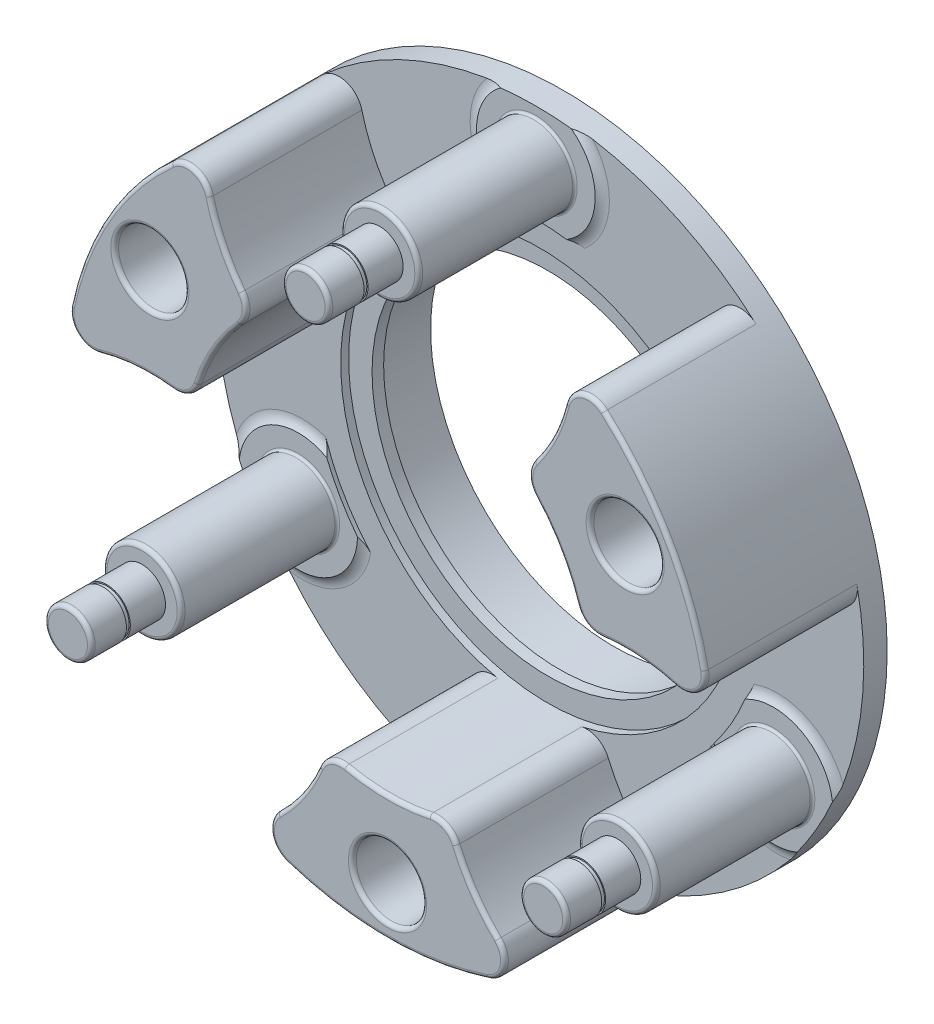
from build123d import *
from build123d.topology import SkipClean

# Parameters (mm, degrees)
SKETCH1_R                = 41.5
SKETCH1_R_2              = 3.000000000000001
SKETCH1_R_3              = 25.5
SKETCH1_R_4              = 2.9999999999999973
SKETCH1_R_5              = 3.0000000000000004
SKETCH1_R_6              = 2.100000000000001
SKETCH1_R_7              = 2.0999999999999988
BOSS_EXTRUDE1_DEPTH      = 3
SKETCH3_R                = 4.5000000000000036
SKETCH3_R_2              = 4.500000000005154
SKETCH3_R_3              = 4.500000000001759
BOSS_EXTRUDE2_DEPTH      = 19.5
SKETCH9_R                = 3.0000000000000018
BOSS_EXTRUDE3_DEPTH      = 0.5
FILLET4_R                = 2
FILLET5_R                = 3
CUT_EXTRUDE5_DEPTH       = 17.5
SKETCH12_R               = 4.999999999999999
CUT_EXTRUDE6_DEPTH       = 2
SKETCH13_R               = 4.500000000000002
SKETCH13_R_2             = 2.100000000000001
BOSS_EXTRUDE5_DEPTH      = 9.5
FILLET7_R                = 0.5
CIRPATTERN2_COUNT        = 3
FILLET4_OF_CIRPATTERN2_R = 2
SKETCH15_R               = 4.500000000000002
SKETCH15_R_2             = 2.100000000000001
SKETCH15_R_3             = 4.500000000000005
SKETCH15_R_4             = 2.0999999999999983
BOSS_EXTRUDE8_DEPTH      = 11.4
CHAMFER2_SIZE            = 0.5
FILLET8_R                = 0.3
BOSS_EXTRUDE10_START     = -3
SKETCH18_R               = 3.000000000000003
BOSS_EXTRUDE10_DEPTH     = 3
CIRPATTERN4_COUNT        = 3
BOSS_EXTRUDE11_START     = 22
SKETCH19_R               = 4.999999999999997
BOSS_EXTRUDE11_DEPTH     = 22
CIRPATTERN6_COUNT        = 3
FILLET11_R               = 0.5
FILLET13_R               = 0.3
SKETCH20_R               = 3.000000000000003
CUT_EXTRUDE7_DEPTH       = 1.5
CIRPATTERN8_COUNT        = 3
SKETCH21_R               = 3.000000000000001
BOSS_EXTRUDE12_DEPTH     = 9.5
CIRPATTERN9_COUNT        = 3
FILLET14_R               = 0.5
SKETCH22_R               = 3.000000000000001
SKETCH22_R_2             = 2.8499999999999996
CUT_EXTRUDE8_DEPTH       = 0.5
CIRPATTERN10_COUNT       = 3


with BuildPart() as part:
    # Sketch1 → Boss-Extrude1 (new body)
    with BuildSketch(Plane.XY):
        Circle(SKETCH1_R)
        with Locations((0, 35.1474)):
            Circle(SKETCH1_R_2, mode=Mode.SUBTRACT)
        Circle(SKETCH1_R_3, mode=Mode.SUBTRACT)
        with Locations((30.438541276975418, -17.573699999998702)):
            Circle(SKETCH1_R_4, mode=Mode.SUBTRACT)
        with Locations((-30.43854127697093, -17.573700000001303)):
            Circle(SKETCH1_R_5, mode=Mode.SUBTRACT)
        with Locations((-30.438541276973226, 17.57369999999992)):
            Circle(SKETCH1_R_6, mode=Mode.SUBTRACT)
        with Locations((30.43854127697314, 17.573700000002663)):
            Circle(SKETCH1_R_6, mode=Mode.SUBTRACT)
        with Locations((2.34127e-12, -35.147399999998726)):
            Circle(SKETCH1_R_7, mode=Mode.SUBTRACT)
    extrude(amount=BOSS_EXTRUDE1_DEPTH)

    # Sketch3 → Boss-Extrude2 (add)
    # profile 1 of 3: a face of its own
    with BuildSketch(Plane.XY.offset(3)):
        with BuildLine():
            ThreePointArc((-17.04322367992892, 18.967828726449188), (-21.649633457038355, 26.00719370167796), (-23.481610059132908, 34.21788989740371))
            ThreePointArc((-23.481610059132755, 34.217889897403595), (-35.94005425705337, 20.750000000001446), (-41.37436694461654, 3.2267258842707123))
            ThreePointArc((-41.374366944616064, 3.2267258842702056), (-33.34770715531379, 5.745535705581741), (-24.948233371699867, 5.2759503059794355))
            ThreePointArc((-24.94823337170057, 5.275950305979563), (-22.083647796501857, 12.750000000002304), (-17.043223679928914, 18.96782872644917))
        make_face()
        with Locations((-30.438541276973226, 17.573699999999914)):
            Circle(SKETCH3_R, mode=Mode.SUBTRACT)
    # profile 2 of 3: a face of its own
    with BuildSketch(Plane.XY.offset(3)):
        with BuildLine():
            ThreePointArc((41.37436694461583, 3.2267258842797224), (35.94005425705123, 20.750000000005144), (23.481610059133157, 34.21788989740332))
            ThreePointArc((23.481610059132883, 34.217889897403126), (21.649633457038238, 26.007193701677682), (17.043223679928904, 18.967828726449163))
            ThreePointArc((17.043223679928907, 18.967828726449177), (22.083647796500625, 12.750000000004434), (24.948233371699555, 5.27595030598437))
            ThreePointArc((24.948233371699835, 5.27595030598442), (33.347707155313074, 5.7455357055883916), (41.37436694461548, 3.2267258842792828))
        make_face()
        with Locations((30.438541276973133, 17.573700000005243)):
            Circle(SKETCH3_R_2, mode=Mode.SUBTRACT)
    # profile 3 of 3: a face of its own
    with BuildSketch(Plane.XY.offset(3)):
        with BuildLine():
            ThreePointArc((-7.905009691767617, -24.243779032425145), (-11.698073698272761, -31.752729407257053), (-17.89275688548132, -37.44461578167187))
            ThreePointArc((-17.892756885481205, -37.44461578167234), (8.7613e-13, -41.50000000000001), (17.892756885482754, -37.4446157816716))
            ThreePointArc((17.89275688548277, -37.44461578167134), (11.698073698274484, -31.752729407256375), (7.905009691769205, -24.24377903242462))
            ThreePointArc((7.905009691769215, -24.243779032424683), (8.1066e-13, -25.5), (-7.905009691767652, -24.24377903242519))
        make_face()
        with Locations((4.57779e-12, -35.14739999999742)):
            Circle(SKETCH3_R_3, mode=Mode.SUBTRACT)
    extrude(amount=BOSS_EXTRUDE2_DEPTH)

    # Sketch9 → Boss-Extrude3 (add)
    with BuildSketch(Plane.XY.offset(3)):
        with BuildLine():
            ThreePointArc((3.9457447685074585, 28.65193248627968), (7.5919415332499876, 34.797508937362196), (4.5264649351877795, 41.25240738660613))
            ThreePointArc((4.5264649351877795, 41.25240738660613), (2.54e-15, 41.50000000000001), (-4.5264649351877795, 41.25240738660613))
            ThreePointArc((-4.5264649351877795, 41.25240738660613), (-7.591941533249986, 34.797508937362196), (-3.9457447685074594, 28.65193248627968))
            ThreePointArc((-3.9457447685074594, 28.65193248627968), (1.77e-15, 28.922346671328953), (3.9457447685074585, 28.65193248627968))
        make_face()
        with Locations((0, 35.1474)):
            Circle(SKETCH9_R, mode=Mode.SUBTRACT)
    boss_extrude3 = extrude(amount=BOSS_EXTRUDE3_DEPTH)

    # Fillet4
    # the kernel refuses this fillet: 2 mm, written as the material it adds along each edge
    with BuildSketch(Plane(origin=(-4.4e-16, 35.14739999999999, 3), x_dir=(-0.20118624054206752, 0.9795530085791934, 0), z_dir=(0.9795530085791934, 0.20118624054206752, 0))) as fillet4_piece_1_section:
        with BuildLine():
            CenterArc((8.922875655532293, 1.9999999999999998), FILLET4_R, 228.59037789072903, 41.40962210927097)
            Line((7.599999999999995, 0.5000000000000017), (7.5735424868893455, 0.4700000000000019))
            ThreePointArc((7.5735424868893455, 0.4700000000000019), (7.5599999999999925, 0.25000000000000083), (7.560000000000029, 0))
            Line((7.560000000000029, 0), (7.600000000000032, -0.04000000000000003))
            Line((7.600000000000032, -0.04000000000000003), (8.922875655532295, -0.04000000000000003))
            Line((8.922875655532295, -0.04000000000000003), (8.922875655532293, 0))
        make_face()
    fillet4_piece_1 = revolve(axis=Axis((-4.4e-16, 35.14739999999999, 3), (0, 0, 1)), revolution_arc=162.0647942771636, mode=Mode.PRIVATE)
    fillet4_piece_1 = fillet4_piece_1 & Plane(origin=(0, 0, 3.1142136524207724), x_dir=(1, 0, 0), z_dir=(0, 0, -1)) * Cylinder(41.5, 36, mode=Mode.PRIVATE)
    fillet4_piece_1 = fillet4_piece_1 - Plane(origin=(-4.4e-16, -6.3238e-13, 3.1142136524207724), x_dir=(-0.1364254710499973, 0.9906503373283564, 0), z_dir=(0, 0, -1)) * Cylinder(28.92234667132958, 36, mode=Mode.PRIVATE)
    add(fillet4_piece_1)
    with BuildSketch(Plane(origin=(1.33e-15, 35.14739999999999, 3), x_dir=(0.11023513080754486, -0.9939055367266265, 0), z_dir=(-0.9939055367266265, -0.11023513080754486, 0))) as fillet4_piece_2_section:
        with BuildLine():
            CenterArc((8.922875655532295, 2), FILLET4_R, 228.59037789072914, 41.409622109270856)
            Line((7.599999999999999, 0.49999999999999956), (7.573542486889352, 0.46999999999999975))
            ThreePointArc((7.573542486889352, 0.46999999999999975), (7.559999999999998, 0.25), (7.56000000000002, 0))
            Line((7.56000000000002, 0), (7.60000000000002, -0.04000000000000004))
            Line((7.60000000000002, -0.04000000000000004), (8.922875655532295, -0.04000000000000004))
            Line((8.922875655532295, -0.04000000000000004), (8.922875655532295, 0))
        make_face()
    fillet4_piece_2 = revolve(axis=Axis((1.33e-15, 35.14739999999999, 3), (0, 0, 1)), revolution_arc=162.06479427716363, mode=Mode.PRIVATE)
    fillet4_piece_2 = fillet4_piece_2 & Plane(origin=(0, 0, 3.1142136533211464), x_dir=(1, 0, 0), z_dir=(0, 0, -1)) * Cylinder(41.5, 36, mode=Mode.PRIVATE)
    fillet4_piece_2 = fillet4_piece_2 - Plane(origin=(-4.4e-16, -6.3238e-13, 3.1142136533211464), x_dir=(-0.1364254710499973, 0.9906503373283564, 0), z_dir=(0, 0, -1)) * Cylinder(28.92234667132958, 36, mode=Mode.PRIVATE)
    add(fillet4_piece_2)

    # Fillet5
    # the kernel refuses this fillet: 3 mm, written as the material it takes off along each edge
    with BuildSketch(Plane(origin=(-41.3743669446163, 3.226725884270455, 3), x_dir=(0.14201179907654285, 0.9898649649942378, 0), z_dir=(0, 0, 1))) as fillet5_piece_1:
        with BuildLine():
            CenterArc((5.169398324781762, -2.993730320620011), FILLET5_R, 86.29510986584997, 117.72061848617085)
            ThreePointArc((2.4290970168052204, -4.214692540142817), (1.3238991334489179, -2.0443231018198946), (0, 0))
            ThreePointArc((0, 0), (2.6816253809806123, 0.08673056475654266), (5.3632507619612255, 0))
        make_face()
    extrude(amount=32.908126904903064, mode=Mode.SUBTRACT)
    with BuildSketch(Plane(origin=(-24.94823337170022, 5.275950305979499, 3), x_dir=(0.25675889841880095, 0.966475487574705, 0), z_dir=(0, 0, 1))) as fillet5_piece_2:
        with BuildLine():
            CenterArc((2.76692669708844, 2.996059200084367), FILLET5_R, 187.71315265443155, 79.34976077385892)
            ThreePointArc((-0.20593055127427304, 2.5934181926630173), (-0.0670495080293914, 1.299560990346834), (0, 0))
            ThreePointArc((0, 0), (1.306604273624909, 0.03349679928286985), (2.613208547249809, -9e-17))
        make_face()
    extrude(amount=26.033021368124523, mode=Mode.SUBTRACT)
    with BuildSketch(Plane(origin=(-17.043223679928918, 18.967828726449177, 3), x_dir=(-0.6472925812907587, 0.7622416376753152, 0), z_dir=(0, 0, 1))) as fillet5_piece_3:
        with BuildLine():
            CenterArc((2.7676396917847796, 2.995400576539178), FILLET5_R, 187.4771359842224, 79.3497607738758)
            ThreePointArc((-0.20685091586524493, 2.6050089462475303), (-0.0700337633072906, 1.305155942949033), (0, 0))
            ThreePointArc((0, 0), (1.300790655138839, 0.03602881710976304), (2.6015813102776955, -3e-17))
        make_face()
    extrude(amount=26.033021368126676, mode=Mode.SUBTRACT)
    with BuildSketch(Plane(origin=(-23.48161005913283, 34.21788989740365, 3), x_dir=(0.1427619117450026, -0.9897570593609889, 0), z_dir=(0, 0, 1))) as fillet5_piece_4:
        with BuildLine():
            CenterArc((5.175085866171874, -2.983887824734681), FILLET5_R, 95.94085094698758, 117.72061848615843)
            ThreePointArc((2.678104690137098, -4.646742300185852), (1.2639086305827807, -2.3666794984363713), (0, 0))
            ThreePointArc((0, 0), (2.432290357100767, -0.12621203957833144), (4.8645807142015185, 6e-17))
        make_face()
    extrude(amount=32.908126904901465, mode=Mode.SUBTRACT)
    with BuildSketch(Plane(origin=(24.948233371699697, 5.275950305984399, 3), x_dir=(-0.25675889841916943, 0.9664754875746071, 0), z_dir=(0, 0, 1))) as fillet5_piece_5:
        with BuildLine():
            CenterArc((2.7669266970879165, -2.9960592000843995), FILLET5_R, 92.9370865716987, 79.34976077386023)
            ThreePointArc((-0.2059305512747297, -2.593418192662554), (-0.06704950802965039, -1.2995609903466103), (0, 0))
            ThreePointArc((0, 0), (1.3066042736249255, -0.03349679928261486), (2.6132085472498505, -6e-17))
        make_face()
    extrude(amount=26.03302136812463, mode=Mode.SUBTRACT)
    with BuildSketch(Plane(origin=(41.37436694461566, 3.226725884279505, 3), x_dir=(-0.14201179907676675, 0.9898649649942056, 0), z_dir=(0, 0, 1))) as fillet5_piece_6:
        with BuildLine():
            CenterArc((5.169398324781412, 2.993730320620015), FILLET5_R, 155.984271647982, 117.72061848616704)
            ThreePointArc((2.4290970168048096, 4.214692540142686), (1.3238991334487102, 2.044323101819835), (0, 0))
            ThreePointArc((0, 0), (2.6816253809804165, -0.08673056475649234), (5.363250761960824, 6e-17))
        make_face()
    extrude(amount=32.90812690490206, mode=Mode.SUBTRACT)
    with BuildSketch(Plane(origin=(23.481610059133025, 34.217889897403225, 3), x_dir=(-0.14276191174505434, -0.9897570593609815, 0), z_dir=(0, 0, 1))) as fillet5_piece_7:
        with BuildLine():
            CenterArc((5.175085866171324, 2.983887824734698), FILLET5_R, 146.33853056685686, 117.72061848615857)
            ThreePointArc((2.678104690136464, 4.646742300185745), (1.2639086305823666, 2.3666794984363593), (0, 0))
            ThreePointArc((0, 0), (2.4322903571005527, 0.12621203957820606), (4.864580714201124, -1e-17))
        make_face()
    extrude(amount=32.90812690490044, mode=Mode.SUBTRACT)
    with BuildSketch(Plane(origin=(17.043223679928907, 18.96782872644917, 3), x_dir=(0.6472925812907598, 0.7622416376753142, 0), z_dir=(0, 0, 1))) as fillet5_piece_8:
        with BuildLine():
            CenterArc((2.7676396917848014, -2.9954005765391774), FILLET5_R, 93.17310324190193, 79.3497607738759)
            ThreePointArc((-0.20685091586522683, -2.605008946247542), (-0.07003376330726978, -1.3051559429490496), (0, 0))
            ThreePointArc((0, 0), (1.3007906551388537, -0.03602881710976737), (2.6015813102777123, 3e-17))
        make_face()
    extrude(amount=26.0330213681267, mode=Mode.SUBTRACT)
    with BuildSketch(Plane(origin=(-7.905009691767635, -24.243779032425167, 3), x_dir=(0.9653717735840792, -0.2608780151088423, 0), z_dir=(0, 0, 1))) as fillet5_piece_9:
        with BuildLine():
            CenterArc((2.766926697088072, -2.996059200084388), FILLET5_R, 92.93708657170235, 79.34976077385885)
            ThreePointArc((-0.2059305512745899, -2.5934181926626616), (-0.06704950802956239, -1.2995609903466645), (0, 0))
            ThreePointArc((0, 0), (1.306604273624906, -0.03349679928270188), (2.613208547249815, -1e-17))
        make_face()
    extrude(amount=26.033021368124537, mode=Mode.SUBTRACT)
    with BuildSketch(Plane(origin=(-17.892756885481262, -37.444615781672105, 3), x_dir=(0.9282541055394802, -0.3719466568596893, 0), z_dir=(0, 0, 1))) as fillet5_piece_10:
        with BuildLine():
            CenterArc((5.169398324781981, 2.9937303206200134), FILLET5_R, 155.9842716479786, 117.72061848617079)
            ThreePointArc((2.429097016805454, 4.214692540142847), (1.32389913344908, 2.04432310181988), (0, 0))
            ThreePointArc((0, 0), (2.6816253809806865, -0.08673056475651277), (5.363250761961412, 0))
        make_face()
    extrude(amount=32.90812690490353, mode=Mode.SUBTRACT)
    with BuildSketch(Plane(origin=(17.892756885482758, -37.44461578167147, 3), x_dir=(-0.9282541055394694, -0.3719466568597162, 0), z_dir=(0, 0, 1))) as fillet5_piece_11:
        with BuildLine():
            CenterArc((5.16939832478169, -2.9937303206200125), FILLET5_R, 86.29510986585171, 117.72061848616684)
            ThreePointArc((2.429097016805103, -4.21469254014271), (1.3238991334489247, -2.0443231018198187), (0, 0))
            ThreePointArc((0, 0), (2.681625380980522, 0.08673056475646362), (5.363250761961062, -8e-17))
        make_face()
    extrude(amount=32.90812690490266, mode=Mode.SUBTRACT)
    with BuildSketch(Plane(origin=(7.9050096917692105, -24.24377903242465, 3), x_dir=(-0.9653717735840623, -0.26087801510890435, 0), z_dir=(0, 0, 1))) as fillet5_piece_12:
        with BuildLine():
            CenterArc((2.7669266970881057, 2.996059200084389), FILLET5_R, 187.71315265443732, 79.34976077386028)
            ThreePointArc((-0.20593055127456747, 2.5934181926627398), (-0.0670495080295619, 1.299560990346695), (0, 0))
            ThreePointArc((0, 0), (1.3066042736249253, 0.03349679928270887), (2.613208547249846, 3e-17))
        make_face()
    extrude(amount=26.03302136812462, mode=Mode.SUBTRACT)

    # Sketch10 → Cut-Extrude5 (cut)
    with SkipClean():  # the faces are left unmerged after this step: merging them gives an invalid solid
        with BuildSketch(Plane(origin=(0, 0, 0), x_dir=(-1, 0, 0), z_dir=(0, 0, -1))):
            with BuildLine():
                ThreePointArc((-29.290515769105856, 8.503863003347483), (-29.017539279441554, 9.393211067893755), (-28.7175663827383, 10.273820178149325))
                ThreePointArc((-28.717566382738358, 10.273820178149368), (-33.757844098667384, 10.848209030714761), (-37.27954390074122, 14.49950366573331))
                ThreePointArc((-37.27954390074116, 14.499503665733304), (-38.34106964762692, 11.400104309862378), (-39.14539599217151, 8.224230822151323))
                ThreePointArc((-39.14539599217151, 8.224230822151327), (-38.700558024866865, 6.818900582741006), (-37.2676944519654, 6.472871855019106))
                ThreePointArc((-37.2676944519654, 6.472871855019111), (-34.022654348244075, 7.165448796156344), (-30.714476806317474, 7.422177145286614))
                ThreePointArc((-30.714476806317474, 7.42217714528661), (-29.823686959517932, 7.727630552913571), (-29.290515769105852, 8.503863003347487))
            make_face()
            with BuildLine():
                ThreePointArc((-31.196710467164433, 25.03528022666748), (-26.27374665549943, 23.81104605107831), (-23.256172459562556, 19.733231933237768))
                ThreePointArc((-23.25617245956254, 19.73323193323776), (-22.64439619458054, 20.432359652833327), (-22.011611339592804, 21.112531023886508))
                ThreePointArc((-22.0116113395928, 21.112531023886504), (-21.606037353269883, 21.96237958558087), (-21.7869335869771, 22.886505869606157))
                ThreePointArc((-21.786933586977092, 22.886505869606157), (-23.21880147694953, 25.879862140672792), (-24.241631081420728, 29.036481696476965))
                ThreePointArc((-24.24163108142073, 29.036481696476965), (-25.257793164485758, 30.10435151696744), (-26.697276827330878, 29.786832829367153))
                ThreePointArc((-26.69727682733088, 29.786832829367153), (-29.044323959215298, 27.50322246123115), (-31.19671046716428, 25.03528022666724))
            make_face()
        cut_extrude5 = extrude(amount=-CUT_EXTRUDE5_DEPTH, mode=Mode.SUBTRACT)

    # Sketch11 → Revolve1 (revolve)
    with SkipClean():  # the faces are left unmerged after this step: merging them gives an invalid solid
        with BuildSketch(Plane(origin=(0, 0, 0), x_dir=(1, 0, 0), z_dir=(0, 1, 0)), mode=Mode.PRIVATE) as revolve1_sk:
            Polygon((-25.500000000000004, 6.5163271707340344), (-23.5, 6.5163271707340344), (-23.5, -0.5), (-22.5, -0.5), (-22.5, -1.9836728292659656), (-25.500000000000004, -1.9836728292659656), align=None)
        revolve(revolve1_sk.sketch.rotate(Axis((0, 0, 0), (0, 0, -1)), 180), axis=Axis((0, 0, 0), (0, 0, -1)))

    # Sketch12 → Cut-Extrude6 (cut)
    with SkipClean():  # the faces are left unmerged after this step: merging them gives an invalid solid
        with BuildSketch(Plane.XY.offset(3.5)):
            with Locations((0, 35.1474)):
                Circle(SKETCH12_R)
        cut_extrude6 = extrude(amount=-CUT_EXTRUDE6_DEPTH, mode=Mode.SUBTRACT)

    # Sketch13 → Boss-Extrude5 (add)
    with SkipClean():  # the faces are left unmerged after this step: merging them gives an invalid solid
        with BuildSketch(Plane.XY.offset(3)):
            with Locations((-30.438541276973226, 17.573699999999914)):
                Circle(SKETCH13_R)
            with Locations((-30.438541276973226, 17.57369999999992)):
                Circle(SKETCH13_R_2, mode=Mode.SUBTRACT)
        extrude(amount=BOSS_EXTRUDE5_DEPTH)

    # Fillet7
    fillet7_edges = [part.edges().sort_by_distance(p)[0] for p in [
        (21.18302071928524, 24.97244873690627, 22.5),
        (-35.94005425705278, 20.75000000000246, 22.5),
        (35.94005425705051, 20.75000000000638, 22.5),
        (1.62537e-12, -41.500000000000014, 22.5),
        (32.218285360505426, 5.85880970335058, 22.5),
        (22.083647796501175, 12.750000000003482, 22.5),
        (39.72319689144136, 5.72484238370884, 22.5),
        (25.52106887290755, 6.189494649312124, 22.5),
        (18.12079403933943, 19.00714665102051, 22.5),
        (24.81945738266606, 31.538876435672478, 22.5),
        (6.1928e-13, -25.500000000000004, 22.5),
        (-22.083647796502405, 12.750000000001346, 22.5),
        (-21.183020719285082, 24.97244873690595, 22.5),
        (-32.2182853605056, 5.858809703344232, 22.5),
        (-39.72319689144118, 5.724842383699793, 22.5),
        (-25.521068872907968, 6.189494649306857, 22.5),
        (-18.12079403933943, 19.00714665102051, 22.5),
        (-24.819457382666094, 31.538876435672545, 22.5),
        (11.03526464122018, -30.83125844024642, 22.5),
        (-11.035264641218017, -30.831258440246465, 22.5),
        (-14.90373950877416, -37.26371881937221, 22.5),
        (-7.400274833566203, -25.196641300324472, 22.5),
        (14.903739508776162, -37.2637188193712, 22.5),
        (7.400274833567389, -25.19664130032457, 22.5),
        (-34.938541276973226, 17.573699999999914, 22.5),
        (25.938541276967978, 17.573700000005243, 22.5),
        (-4.499999999997181, -35.14739999999742, 22.5),
    ]]
    fillet(fillet7_edges, radius=FILLET7_R)

    # CirPattern2: Boss-Extrude3, Cut-Extrude5, Cut-Extrude6 ×3 about axis
    cirpattern2_axis = Axis((1.0439e-13, -2.77e-15, 0), (0, 0, 1))
    add([boss_extrude3.rotate(cirpattern2_axis, i * 360 / CIRPATTERN2_COUNT) for i in range(1, CIRPATTERN2_COUNT)])
    add([cut_extrude5.rotate(cirpattern2_axis, i * 360 / CIRPATTERN2_COUNT) for i in range(1, CIRPATTERN2_COUNT)], mode=Mode.SUBTRACT)
    add([cut_extrude6.rotate(cirpattern2_axis, i * 360 / CIRPATTERN2_COUNT) for i in range(1, CIRPATTERN2_COUNT)], mode=Mode.SUBTRACT)

    # Fillet4 of CirPattern2
    # the kernel refuses this fillet: 2 mm, written as the material it adds along each edge
    with BuildSketch(Plane(origin=(-30.43854127697302, -17.573700000000084, 3), x_dir=(-0.7477246695120235, -0.6640088994909144, 0), z_dir=(-0.6640088994909144, 0.7477246695120235, 0))) as fillet4_of_cirpattern2_piece_1_section:
        with BuildLine():
            CenterArc((8.92287565553229, 2), FILLET4_OF_CIRPATTERN2_R, 228.59037789072912, 41.40962210927091)
            Line((7.599999999999993, 0.5000000000000009), (7.573542486889347, 0.4700000000000011))
            ThreePointArc((7.573542486889347, 0.4700000000000011), (7.559999999999996, 0.25000000000000044), (7.559999999999993, 0))
            Line((7.559999999999993, 0), (7.599999999999999, -0.04000000000000004))
            Line((7.599999999999999, -0.04000000000000004), (8.92287565553229, -0.04000000000000004))
            Line((8.92287565553229, -0.04000000000000004), (8.92287565553229, 0))
        make_face()
    fillet4_of_cirpattern2_piece_1 = revolve(axis=Axis((-30.43854127697302, -17.573700000000084, 3), (0, 0, 1)), revolution_arc=162.0647942771636, mode=Mode.PRIVATE)
    fillet4_of_cirpattern2_piece_1 = fillet4_of_cirpattern2_piece_1 & Plane(origin=(0, 0, 3.1142136524207724), x_dir=(1, 0, 0), z_dir=(0, 0, -1)) * Cylinder(41.5, 36, mode=Mode.PRIVATE)
    fillet4_of_cirpattern2_piece_1 = fillet4_of_cirpattern2_piece_1 - Plane(origin=(7.0207e-13, 2.2125e-13, 3.1142136524207724), x_dir=(-0.7897156228689817, -0.6134730923167342, 0), z_dir=(0, 0, -1)) * Cylinder(28.92234667132958, 36, mode=Mode.PRIVATE)
    add(fillet4_of_cirpattern2_piece_1)
    with BuildSketch(Plane(origin=(-30.43854127697302, -17.573700000000084, 3), x_dir=(0.8056298783634935, 0.5924191920321475, 0), z_dir=(0.5924191920321475, -0.8056298783634935, 0))) as fillet4_of_cirpattern2_piece_2_section:
        with BuildLine():
            CenterArc((8.922875655532295, 1.9999999999999998), FILLET4_OF_CIRPATTERN2_R, 228.59037789072914, 41.409622109270856)
            Line((7.6, 0.4999999999999995), (7.5735424868893535, 0.4699999999999997))
            ThreePointArc((7.5735424868893535, 0.4699999999999997), (7.559999999999996, 0.24999999999999997), (7.5600000000000005, 0))
            Line((7.5600000000000005, 0), (7.6000000000000005, -0.04000000000000003))
            Line((7.6000000000000005, -0.04000000000000003), (8.922875655532295, -0.04000000000000003))
            Line((8.922875655532295, -0.04000000000000003), (8.922875655532295, 0))
        make_face()
    fillet4_of_cirpattern2_piece_2 = revolve(axis=Axis((-30.43854127697302, -17.573700000000084, 3), (0, 0, 1)), revolution_arc=162.06479427716363, mode=Mode.PRIVATE)
    fillet4_of_cirpattern2_piece_2 = fillet4_of_cirpattern2_piece_2 & Plane(origin=(0, 0, 3.1142136533211433), x_dir=(1, 0, 0), z_dir=(0, 0, -1)) * Cylinder(41.5, 36, mode=Mode.PRIVATE)
    fillet4_of_cirpattern2_piece_2 = fillet4_of_cirpattern2_piece_2 - Plane(origin=(7.0207e-13, 2.2125e-13, 3.1142136533211433), x_dir=(-0.7897156228689817, -0.6134730923167342, 0), z_dir=(0, 0, -1)) * Cylinder(28.92234667132958, 36, mode=Mode.PRIVATE)
    add(fillet4_of_cirpattern2_piece_2)
    with BuildSketch(Plane(origin=(30.43854127697332, -17.573699999999924, 3), x_dir=(0.9489109100540908, -0.315544109088281, 0), z_dir=(-0.315544109088281, -0.9489109100540908, 0))) as fillet4_of_cirpattern2_piece_3_section:
        with BuildLine():
            CenterArc((8.922875655532286, 1.9999999999999996), FILLET4_OF_CIRPATTERN2_R, 228.59037789072914, 41.409622109270856)
            Line((7.599999999999991, 0.499999999999999), (7.573542486889343, 0.4699999999999992))
            ThreePointArc((7.573542486889343, 0.4699999999999992), (7.5600000000000005, 0.2499999999999995), (7.560000000000032, 0))
            Line((7.560000000000032, 0), (7.60000000000003, -0.04000000000000003))
            Line((7.60000000000003, -0.04000000000000003), (8.922875655532286, -0.04000000000000003))
            Line((8.922875655532286, -0.04000000000000003), (8.922875655532286, 0))
        make_face()
    fillet4_of_cirpattern2_piece_3 = revolve(axis=Axis((30.43854127697332, -17.573699999999924, 3), (0, 0, 1)), revolution_arc=162.06479427716377, mode=Mode.PRIVATE)
    fillet4_of_cirpattern2_piece_3 = fillet4_of_cirpattern2_piece_3 & Plane(origin=(0, 0, 3.114213652420772), x_dir=(1, 0, 0), z_dir=(0, 0, -1)) * Cylinder(41.5, 36, mode=Mode.PRIVATE)
    fillet4_of_cirpattern2_piece_3 = fillet4_of_cirpattern2_piece_3 - Plane(origin=(-3.8845e-13, 4.0283e-13, 3.114213652420772), x_dir=(0.9261410939189787, -0.37717724501162253, 0), z_dir=(0, 0, -1)) * Cylinder(28.92234667132958, 36, mode=Mode.PRIVATE)
    add(fillet4_of_cirpattern2_piece_3)
    with BuildSketch(Plane(origin=(30.43854127697332, -17.573699999999924, 3), x_dir=(-0.9158650091710376, 0.40148634469448025, 0), z_dir=(0.40148634469448025, 0.9158650091710376, 0))) as fillet4_of_cirpattern2_piece_4_section:
        with BuildLine():
            CenterArc((8.922875655532293, 1.9999999999999998), FILLET4_OF_CIRPATTERN2_R, 228.59037789072912, 41.40962210927091)
            Line((7.599999999999997, 0.5000000000000008), (7.573542486889353, 0.47000000000000103))
            ThreePointArc((7.573542486889353, 0.47000000000000103), (7.559999999999997, 0.2500000000000004), (7.560000000000021, 0))
            Line((7.560000000000021, 0), (7.600000000000023, -0.04000000000000003))
            Line((7.600000000000023, -0.04000000000000003), (8.922875655532293, -0.04000000000000003))
            Line((8.922875655532293, -0.04000000000000003), (8.922875655532293, 0))
        make_face()
    fillet4_of_cirpattern2_piece_4 = revolve(axis=Axis((30.43854127697332, -17.573699999999924, 3), (0, 0, 1)), revolution_arc=162.06479427716377, mode=Mode.PRIVATE)
    fillet4_of_cirpattern2_piece_4 = fillet4_of_cirpattern2_piece_4 & Plane(origin=(0, 0, 3.114213653321144), x_dir=(1, 0, 0), z_dir=(0, 0, -1)) * Cylinder(41.5, 36, mode=Mode.PRIVATE)
    fillet4_of_cirpattern2_piece_4 = fillet4_of_cirpattern2_piece_4 - Plane(origin=(-3.8845e-13, 4.0283e-13, 3.114213653321144), x_dir=(0.9261410939189787, -0.37717724501162253, 0), z_dir=(0, 0, -1)) * Cylinder(28.92234667132958, 36, mode=Mode.PRIVATE)
    add(fillet4_of_cirpattern2_piece_4)

    # Sketch15 → Boss-Extrude8 (add)
    # profile 1 of 2: a face of its own
    with BuildSketch(Plane.XY.offset(3)):
        with Locations((30.43854127697314, 17.573700000002663)):
            Circle(SKETCH15_R)
        with Locations((30.43854127697314, 17.573700000002663)):
            Circle(SKETCH15_R_2, mode=Mode.SUBTRACT)
    # profile 2 of 2: a face of its own
    with BuildSketch(Plane.XY.offset(3)):
        with Locations((2.34127e-12, -35.147399999998726)):
            Circle(SKETCH15_R_3)
        with Locations((2.34127e-12, -35.147399999998726)):
            Circle(SKETCH15_R_4, mode=Mode.SUBTRACT)
    extrude(amount=BOSS_EXTRUDE8_DEPTH)

    # Chamfer2
    chamfer2_edges = [part.edges().sort_by_distance(p)[0] for p in [
        (-34.938541276973226, 17.573699999999914, 12.5),
        (25.93854127697314, 17.573700000002663, 14.4),
        (-4.499999999997664, -35.147399999998726, 14.4),
    ]]
    chamfer(chamfer2_edges, length=CHAMFER2_SIZE)

    # Fillet8
    fillet8_edges = [part.edges().sort_by_distance(p)[0] for p in [
        (-23.5, 4.68e-15, 0.5),
    ]]
    fillet(fillet8_edges, radius=FILLET8_R)

    # Sketch18 → Boss-Extrude10 (add)
    with SkipClean():  # the faces are left unmerged after this step: merging them gives an invalid solid
        with BuildSketch(Plane.XY.offset(1.5).offset(BOSS_EXTRUDE10_START)):
            with Locations((0, 35.1474)):
                Circle(SKETCH18_R)
        boss_extrude10 = extrude(amount=BOSS_EXTRUDE10_DEPTH)

    # CirPattern4: Boss-Extrude10 ×3 about axis
    with SkipClean():  # the faces are left unmerged after this step: merging them gives an invalid solid
        cirpattern4_axis = Axis((-1.6e-15, -3.24e-15, 0), (0, 0, 1))
        for i in range(1, CIRPATTERN4_COUNT):
            add(boss_extrude10.rotate(cirpattern4_axis, i * 360 / CIRPATTERN4_COUNT))

    # Sketch19 → Boss-Extrude11 (add)
    with SkipClean():  # the faces are left unmerged after this step: merging them gives an invalid solid
        with BuildSketch(Plane.XY.offset(1.5).offset(BOSS_EXTRUDE11_START)):
            with Locations((0, 35.1474)):
                Circle(SKETCH19_R)
        boss_extrude11 = extrude(amount=-BOSS_EXTRUDE11_DEPTH)

    # CirPattern6: Boss-Extrude11 ×3 about axis
    with SkipClean():  # the faces are left unmerged after this step: merging them gives an invalid solid
        cirpattern6_axis = Axis((-1.6e-15, -3.24e-15, 0), (0, 0, 1))
        for i in range(1, CIRPATTERN6_COUNT):
            add(boss_extrude11.rotate(cirpattern6_axis, i * 360 / CIRPATTERN6_COUNT))

    # Fillet11
    fillet11_edges = [part.edges().sort_by_distance(p)[0] for p in [
        (-4.999999999999997, 35.1474, 23.5),
        (-27.938541276973186, -21.903827018922186, 23.5),
        (32.93854127697317, -13.24357298107783, 23.5),
    ]]
    fillet(fillet11_edges, radius=FILLET11_R)

    # Fillet13
    fillet13_edges = [part.edges().sort_by_distance(p)[0] for p in [
        (-4.999999999999999, 35.1474, 3.5),
        (-27.93854127697303, -21.903827018922282, 3.5),
        (32.938541276973325, -13.243572981077735, 3.5),
    ]]
    fillet(fillet13_edges, radius=FILLET13_R)

    # Sketch20 → Cut-Extrude7 (cut)
    with SkipClean():  # the faces are left unmerged after this step: merging them gives an invalid solid
        with BuildSketch(Plane(origin=(0, 0, -1.5), x_dir=(-1, 0, 0), z_dir=(0, 0, -1))):
            with Locations((0, 35.1474)):
                Circle(SKETCH20_R)
        cut_extrude7 = extrude(amount=-CUT_EXTRUDE7_DEPTH, mode=Mode.SUBTRACT)

    # CirPattern8: Cut-Extrude7 ×3 about axis
    with SkipClean():  # the faces are left unmerged after this step: merging them gives an invalid solid
        cirpattern8_axis = Axis((0, 0, 0), (0, 0, -1))
        for i in range(1, CIRPATTERN8_COUNT):
            add(cut_extrude7.rotate(cirpattern8_axis, i * 360 / CIRPATTERN8_COUNT), mode=Mode.SUBTRACT)

    # Sketch21 → Boss-Extrude12 (add)
    with SkipClean():  # the faces are left unmerged after this step: merging them gives an invalid solid
        with BuildSketch(Plane.XY.offset(23.5)):
            with Locations((0, 35.1474)):
                Circle(SKETCH21_R)
        boss_extrude12 = extrude(amount=BOSS_EXTRUDE12_DEPTH)

    # CirPattern9: Boss-Extrude12 ×3 about axis
    with SkipClean():  # the faces are left unmerged after this step: merging them gives an invalid solid
        cirpattern9_axis = Axis((-1.6e-15, -3.24e-15, 0), (0, 0, 1))
        for i in range(1, CIRPATTERN9_COUNT):
            add(boss_extrude12.rotate(cirpattern9_axis, i * 360 / CIRPATTERN9_COUNT))

    # Fillet14
    fillet14_edges = [part.edges().sort_by_distance(p)[0] for p in [
        (-3.000000000000001, 35.1474, 33),
        (-28.938541276973183, -20.17177621135331, 33),
        (31.93854127697317, -14.975623788646704, 33),
    ]]
    fillet(fillet14_edges, radius=FILLET14_R)

    # Sketch22 → Cut-Extrude8 (cut)
    with SkipClean():  # the faces are left unmerged after this step: merging them gives an invalid solid
        with BuildSketch(Plane.XY.offset(28)):
            with Locations((0, 35.1474)):
                Circle(SKETCH22_R)
            with Locations((0, 35.1474)):
                Circle(SKETCH22_R_2, mode=Mode.SUBTRACT)
        cut_extrude8 = extrude(amount=CUT_EXTRUDE8_DEPTH, mode=Mode.SUBTRACT)

    # CirPattern10: Cut-Extrude8 ×3 about axis
    with SkipClean():  # the faces are left unmerged after this step: merging them gives an invalid solid
        cirpattern10_axis = Axis((-1.6e-15, -3.24e-15, 0), (0, 0, 1))
        for i in range(1, CIRPATTERN10_COUNT):
            add(cut_extrude8.rotate(cirpattern10_axis, i * 360 / CIRPATTERN10_COUNT), mode=Mode.SUBTRACT)


solid = part.part
